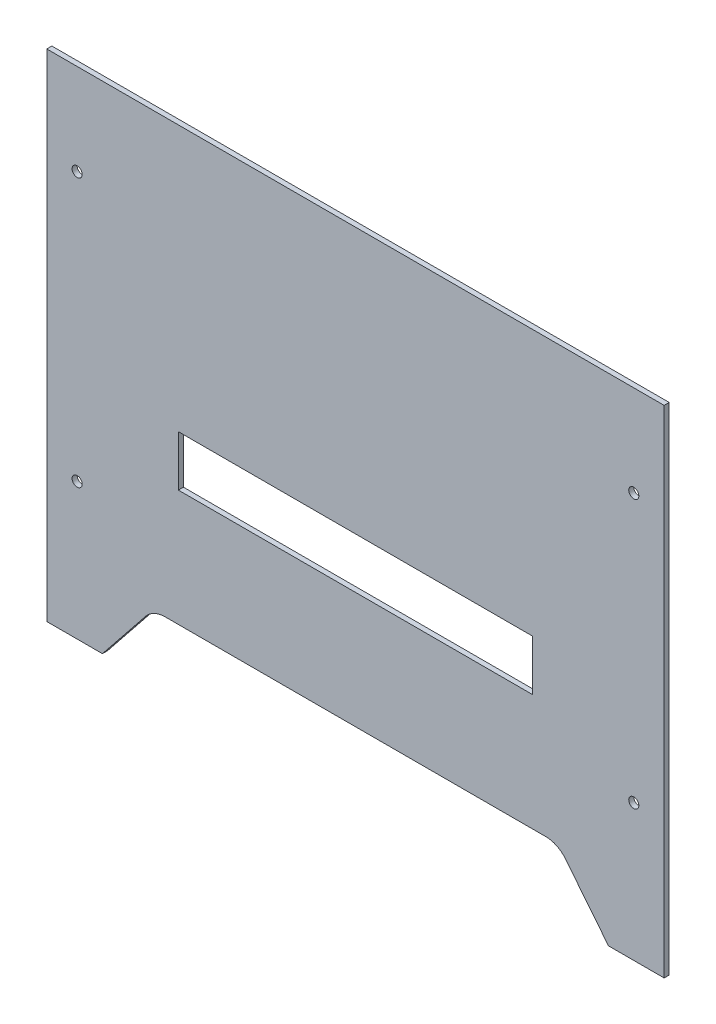
from build123d import *

# Parameters (mm, degrees)
SKETCH1_R           = 2
SKETCH1_W           = 140
SKETCH1_H           = 20
BOSS_EXTRUDE1_DEPTH = 2


with BuildPart() as part:
    # Sketch1 → Boss-Extrude1 (new body)
    with BuildSketch(Plane.XY):
        with BuildLine():
            Line((-122, -98), (-122, 98))
            Line((-122, 98), (122, 98))
            Line((122, 98), (122, -98))
            Line((122, -98), (100, -98))
            Line((100, -98), (83.00243962, -76.753049524))
            ThreePointArc((83.00243962, -76.753049524), (79.52563883, -73.986967637), (75.193751525, -73))
            Line((75.193751525, -73), (-75.193751525, -73))
            ThreePointArc((-75.193751525, -73), (-79.52563883, -73.986967637), (-83.00243962, -76.753049524))
            Line((-83.00243962, -76.753049524), (-100, -98))
            Line((-100, -98), (-122, -98))
        make_face()
        with Locations((110, 62)):
            Circle(SKETCH1_R, mode=Mode.SUBTRACT)
        with Locations((110, -44)):
            Circle(SKETCH1_R, mode=Mode.SUBTRACT)
        with Locations((-110, -44)):
            Circle(SKETCH1_R, mode=Mode.SUBTRACT)
        with Locations((-110, 62)):
            Circle(SKETCH1_R, mode=Mode.SUBTRACT)
        with Locations((0, -17)):
            Rectangle(SKETCH1_W, SKETCH1_H, mode=Mode.SUBTRACT)
    extrude(amount=BOSS_EXTRUDE1_DEPTH)


solid = part.part
